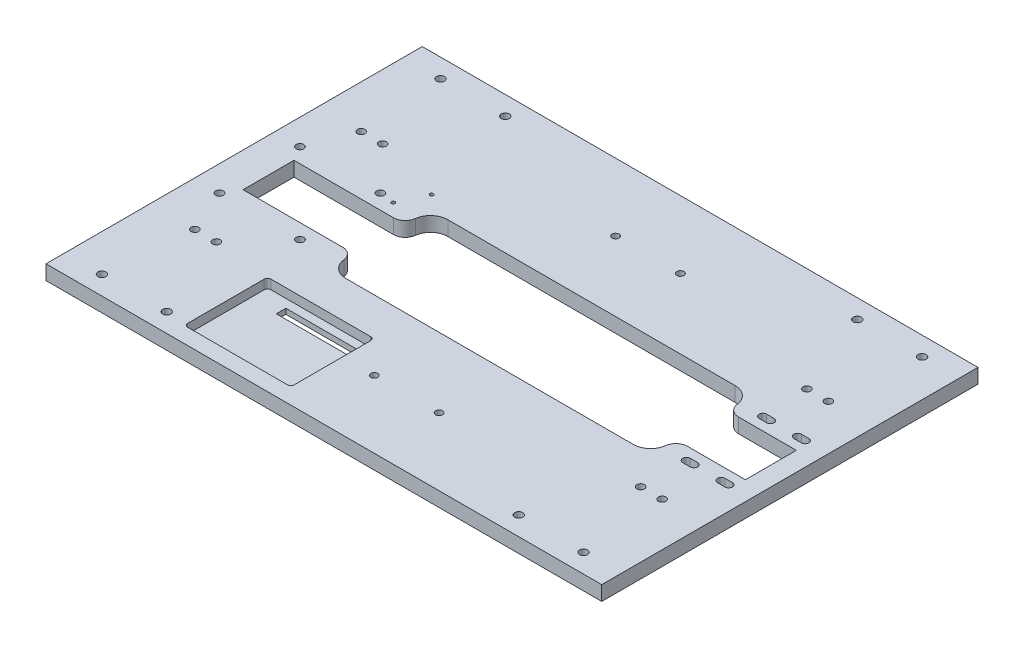
from build123d import *

# Parameters (mm, degrees)
SKETCH1_W           = 480
SKETCH1_H           = 325
BOSS_EXTRUDE1_DEPTH = 12.6
CUT_EXTRUDE1_REACH  = 292.112
SKETCH2_R           = 3
CUT_EXTRUDE2_REACH  = 292.112
FILLET1_R           = 10
CUT_EXTRUDE3_REACH  = 292.112
SKETCH4_R           = 3.3
FILLET2_R           = 10
CUT_EXTRUDE7_REACH  = 292.112
SKETCH7_R           = 2.25
SKETCH8_R           = 3.5
CUT_EXTRUDE8_DEPTH  = 6
CUT_EXTRUDE11_REACH = 292.112
SKETCH12_R          = 1.5
FILLET3_R           = 15
CUT_EXTRUDE12_DEPTH = 8
SKETCH14_W          = 63.584161833
SKETCH14_H          = 8.257095536
CUT_EXTRUDE13_DEPTH = 290.948702501
CUT_EXTRUDE14_REACH = 292.112
SKETCH15_R          = 3.25
CUT_EXTRUDE15_REACH = 292.112


with BuildPart() as part:
    # Sketch1 → Boss-Extrude1 (new body)
    with BuildSketch(Plane(origin=(0, 0, 0), x_dir=(1, 0, 0), z_dir=(0, 1, 0))):
        Rectangle(SKETCH1_W, SKETCH1_H)
    extrude(amount=BOSS_EXTRUDE1_DEPTH)

    # Sketch2 → Cut-Extrude1 (cut, up to next)
    with BuildSketch(Plane.XZ, mode=Mode.PRIVATE) as cut_extrude1_sk1:
        with Locations((41.247428317, -104.2)):
            Circle(SKETCH2_R)
    cut_extrude1_tool1 = extrude(cut_extrude1_sk1.sketch, amount=-CUT_EXTRUDE1_REACH, mode=Mode.PRIVATE) & part.part
    # Sketch2 → Cut-Extrude1 (cut, up to next)
    with BuildSketch(Plane.XZ, mode=Mode.PRIVATE) as cut_extrude1_sk2:
        with Locations((-14.752571683, -104.2)):
            Circle(SKETCH2_R)
    cut_extrude1_tool2 = extrude(cut_extrude1_sk2.sketch, amount=-CUT_EXTRUDE1_REACH, mode=Mode.PRIVATE) & part.part
    # Sketch2 → Cut-Extrude1 (cut, up to next)
    with BuildSketch(Plane.XZ, mode=Mode.PRIVATE) as cut_extrude1_sk3:
        with Locations((41.247428317, 104.2)):
            Circle(SKETCH2_R)
    cut_extrude1_tool3 = extrude(cut_extrude1_sk3.sketch, amount=-CUT_EXTRUDE1_REACH, mode=Mode.PRIVATE) & part.part
    # Sketch2 → Cut-Extrude1 (cut, up to next)
    with BuildSketch(Plane.XZ, mode=Mode.PRIVATE) as cut_extrude1_sk4:
        with Locations((-14.752571683, 104.2)):
            Circle(SKETCH2_R)
    cut_extrude1_tool4 = extrude(cut_extrude1_sk4.sketch, amount=-CUT_EXTRUDE1_REACH, mode=Mode.PRIVATE) & part.part
    add(cut_extrude1_tool1.solids().sort_by_distance((41.247428, 0, -104.2))[0], mode=Mode.SUBTRACT)
    add(cut_extrude1_tool2.solids().sort_by_distance((-14.752572, 0, -104.2))[0], mode=Mode.SUBTRACT)
    add(cut_extrude1_tool3.solids().sort_by_distance((41.247428, 0, 104.2))[0], mode=Mode.SUBTRACT)
    add(cut_extrude1_tool4.solids().sort_by_distance((-14.752572, 0, 104.2))[0], mode=Mode.SUBTRACT)

    # Sketch3 → Cut-Extrude2 (cut, up to next)
    with BuildSketch(Plane.XZ, mode=Mode.PRIVATE) as cut_extrude2_sk1:
        Polygon((163.584746975, 44), (-114.288669968, 44), (-114.288669968, 22), (-210.288669968, 22), (-210.288669968, -22), (-114.288669968, -22), (-114.288669968, -44), (163.584746975, -44), (163.584746975, -22), (223.584746975, -22), (223.584746975, 22), (163.584746975, 22), align=None)
    cut_extrude2_tool1 = extrude(cut_extrude2_sk1.sketch, amount=-CUT_EXTRUDE2_REACH, mode=Mode.PRIVATE) & part.part
    add(cut_extrude2_tool1.solids().sort_by_distance((13.675427, 0, 0))[0], mode=Mode.SUBTRACT)

    # Fillet1
    fillet1_edges = [part.edges().sort_by_distance(p)[0] for p in [
        (-114.288669968, 6.3, 22),
        (-114.288669968, 6.3, -22),
    ]]
    fillet(fillet1_edges, radius=FILLET1_R)

    # Sketch4 → Cut-Extrude3 (cut, up to next)
    with BuildSketch(Plane.XZ, mode=Mode.PRIVATE) as cut_extrude3_sk1:
        with Locations((-148.425714853, -34.75)):
            Circle(SKETCH4_R)
    cut_extrude3_tool1 = extrude(cut_extrude3_sk1.sketch, amount=-CUT_EXTRUDE3_REACH, mode=Mode.PRIVATE) & part.part
    # Sketch4 → Cut-Extrude3 (cut, up to next)
    with BuildSketch(Plane.XZ, mode=Mode.PRIVATE) as cut_extrude3_sk2:
        with Locations((-148.425714853, 34.75)):
            Circle(SKETCH4_R)
    cut_extrude3_tool2 = extrude(cut_extrude3_sk2.sketch, amount=-CUT_EXTRUDE3_REACH, mode=Mode.PRIVATE) & part.part
    # Sketch4 → Cut-Extrude3 (cut, up to next)
    with BuildSketch(Plane.XZ, mode=Mode.PRIVATE) as cut_extrude3_sk3:
        with Locations((-217.925714853, 34.75)):
            Circle(SKETCH4_R)
    cut_extrude3_tool3 = extrude(cut_extrude3_sk3.sketch, amount=-CUT_EXTRUDE3_REACH, mode=Mode.PRIVATE) & part.part
    # Sketch4 → Cut-Extrude3 (cut, up to next)
    with BuildSketch(Plane.XZ, mode=Mode.PRIVATE) as cut_extrude3_sk4:
        with Locations((-217.925714853, -34.75)):
            Circle(SKETCH4_R)
    cut_extrude3_tool4 = extrude(cut_extrude3_sk4.sketch, amount=-CUT_EXTRUDE3_REACH, mode=Mode.PRIVATE) & part.part
    add(cut_extrude3_tool1.solids().sort_by_distance((-148.425715, 0, -34.75))[0], mode=Mode.SUBTRACT)
    add(cut_extrude3_tool2.solids().sort_by_distance((-148.425715, 0, 34.75))[0], mode=Mode.SUBTRACT)
    add(cut_extrude3_tool3.solids().sort_by_distance((-217.925715, 0, 34.75))[0], mode=Mode.SUBTRACT)
    add(cut_extrude3_tool4.solids().sort_by_distance((-217.925715, 0, -34.75))[0], mode=Mode.SUBTRACT)

    # Fillet2
    fillet2_edges = [part.edges().sort_by_distance(p)[0] for p in [
        (163.584746975, 6.3, -22),
        (163.584746975, 6.3, 22),
    ]]
    fillet(fillet2_edges, radius=FILLET2_R)

    # Sketch7 → Cut-Extrude7 (cut, up to next)
    with BuildSketch(Plane(origin=(0, 12.6, 0), x_dir=(1, 0, 0), z_dir=(0, 1, 0)), mode=Mode.PRIVATE) as cut_extrude7_sk1:
        with Locations((208, -146.2)):
            Circle(SKETCH7_R)
    cut_extrude7_tool1 = extrude(cut_extrude7_sk1.sketch, amount=-CUT_EXTRUDE7_REACH, mode=Mode.PRIVATE) & part.part
    # Sketch7 → Cut-Extrude7 (cut, up to next)
    with BuildSketch(Plane(origin=(0, 12.6, 0), x_dir=(1, 0, 0), z_dir=(0, 1, 0)), mode=Mode.PRIVATE) as cut_extrude7_sk2:
        with Locations((152, -146.2)):
            Circle(SKETCH7_R)
    cut_extrude7_tool2 = extrude(cut_extrude7_sk2.sketch, amount=-CUT_EXTRUDE7_REACH, mode=Mode.PRIVATE) & part.part
    # Sketch7 → Cut-Extrude7 (cut, up to next)
    with BuildSketch(Plane(origin=(0, 12.6, 0), x_dir=(1, 0, 0), z_dir=(0, 1, 0)), mode=Mode.PRIVATE) as cut_extrude7_sk3:
        with Locations((-152, -146.2)):
            Circle(SKETCH7_R)
    cut_extrude7_tool3 = extrude(cut_extrude7_sk3.sketch, amount=-CUT_EXTRUDE7_REACH, mode=Mode.PRIVATE) & part.part
    # Sketch7 → Cut-Extrude7 (cut, up to next)
    with BuildSketch(Plane(origin=(0, 12.6, 0), x_dir=(1, 0, 0), z_dir=(0, 1, 0)), mode=Mode.PRIVATE) as cut_extrude7_sk4:
        with Locations((-208, -146.2)):
            Circle(SKETCH7_R)
    cut_extrude7_tool4 = extrude(cut_extrude7_sk4.sketch, amount=-CUT_EXTRUDE7_REACH, mode=Mode.PRIVATE) & part.part
    # Sketch7 → Cut-Extrude7 (cut, up to next)
    with BuildSketch(Plane(origin=(0, 12.6, 0), x_dir=(1, 0, 0), z_dir=(0, 1, 0)), mode=Mode.PRIVATE) as cut_extrude7_sk5:
        with Locations((-208, 146.2)):
            Circle(SKETCH7_R)
    cut_extrude7_tool5 = extrude(cut_extrude7_sk5.sketch, amount=-CUT_EXTRUDE7_REACH, mode=Mode.PRIVATE) & part.part
    # Sketch7 → Cut-Extrude7 (cut, up to next)
    with BuildSketch(Plane(origin=(0, 12.6, 0), x_dir=(1, 0, 0), z_dir=(0, 1, 0)), mode=Mode.PRIVATE) as cut_extrude7_sk6:
        with Locations((-152, 146.2)):
            Circle(SKETCH7_R)
    cut_extrude7_tool6 = extrude(cut_extrude7_sk6.sketch, amount=-CUT_EXTRUDE7_REACH, mode=Mode.PRIVATE) & part.part
    # Sketch7 → Cut-Extrude7 (cut, up to next)
    with BuildSketch(Plane(origin=(0, 12.6, 0), x_dir=(1, 0, 0), z_dir=(0, 1, 0)), mode=Mode.PRIVATE) as cut_extrude7_sk7:
        with Locations((208, 146.2)):
            Circle(SKETCH7_R)
    cut_extrude7_tool7 = extrude(cut_extrude7_sk7.sketch, amount=-CUT_EXTRUDE7_REACH, mode=Mode.PRIVATE) & part.part
    # Sketch7 → Cut-Extrude7 (cut, up to next)
    with BuildSketch(Plane(origin=(0, 12.6, 0), x_dir=(1, 0, 0), z_dir=(0, 1, 0)), mode=Mode.PRIVATE) as cut_extrude7_sk8:
        with Locations((152, 146.2)):
            Circle(SKETCH7_R)
    cut_extrude7_tool8 = extrude(cut_extrude7_sk8.sketch, amount=-CUT_EXTRUDE7_REACH, mode=Mode.PRIVATE) & part.part
    add(cut_extrude7_tool1.solids().sort_by_distance((208, 12.6, 146.2))[0], mode=Mode.SUBTRACT)
    add(cut_extrude7_tool2.solids().sort_by_distance((152, 12.6, 146.2))[0], mode=Mode.SUBTRACT)
    add(cut_extrude7_tool3.solids().sort_by_distance((-152, 12.6, 146.2))[0], mode=Mode.SUBTRACT)
    add(cut_extrude7_tool4.solids().sort_by_distance((-208, 12.6, 146.2))[0], mode=Mode.SUBTRACT)
    add(cut_extrude7_tool5.solids().sort_by_distance((-208, 12.6, -146.2))[0], mode=Mode.SUBTRACT)
    add(cut_extrude7_tool6.solids().sort_by_distance((-152, 12.6, -146.2))[0], mode=Mode.SUBTRACT)
    add(cut_extrude7_tool7.solids().sort_by_distance((208, 12.6, -146.2))[0], mode=Mode.SUBTRACT)
    add(cut_extrude7_tool8.solids().sort_by_distance((152, 12.6, -146.2))[0], mode=Mode.SUBTRACT)

    # Sketch8 → Cut-Extrude8 (cut)
    with BuildSketch(Plane(origin=(0, 12.6, 0), x_dir=(1, 0, 0), z_dir=(0, 1, 0))):
        with Locations((208, 146.2)):
            Circle(SKETCH8_R)
        with Locations((152, 146.2)):
            Circle(SKETCH8_R)
        with Locations((-152, 146.2)):
            Circle(SKETCH8_R)
        with Locations((-208, 146.2)):
            Circle(SKETCH8_R)
        with Locations((208, -146.2)):
            Circle(SKETCH8_R)
        with Locations((152, -146.2)):
            Circle(SKETCH8_R)
        with Locations((-208, -146.2)):
            Circle(SKETCH8_R)
        with Locations((-152, -146.2)):
            Circle(SKETCH8_R)
    extrude(amount=-CUT_EXTRUDE8_DEPTH, mode=Mode.SUBTRACT)

    # Sketch12 → Cut-Extrude11 (cut, up to next)
    with BuildSketch(Plane.XZ, mode=Mode.PRIVATE) as cut_extrude11_sk1:
        with Locations((-135.814791711, -33.263055365)):
            Circle(SKETCH12_R)
    cut_extrude11_tool1 = extrude(cut_extrude11_sk1.sketch, amount=-CUT_EXTRUDE11_REACH, mode=Mode.PRIVATE) & part.part
    # Sketch12 → Cut-Extrude11 (cut, up to next)
    with BuildSketch(Plane.XZ, mode=Mode.PRIVATE) as cut_extrude11_sk2:
        with Locations((-125.214791711, -55.863055365)):
            Circle(SKETCH12_R)
    cut_extrude11_tool2 = extrude(cut_extrude11_sk2.sketch, amount=-CUT_EXTRUDE11_REACH, mode=Mode.PRIVATE) & part.part
    add(cut_extrude11_tool1.solids().sort_by_distance((-135.814792, 0, -33.263055))[0], mode=Mode.SUBTRACT)
    add(cut_extrude11_tool2.solids().sort_by_distance((-125.214792, 0, -55.863055))[0], mode=Mode.SUBTRACT)

    # Fillet3
    fillet3_edges = [part.edges().sort_by_distance(p)[0] for p in [
        (163.584746975, 6.3, 44),
        (163.584746975, 6.3, -44),
        (-114.288669968, 6.3, 44),
        (-114.288669968, 6.3, -44),
    ]]
    fillet(fillet3_edges, radius=FILLET3_R)

    # Sketch9 → Cut-Extrude12 (cut)
    with BuildSketch(Plane(origin=(0, 12.6, 0), x_dir=(1, 0, 0), z_dir=(0, 1, 0))):
        with BuildLine():
            Line((-131.275181306, -76.793200215), (-45.275181306, -76.793200215))
            ThreePointArc((-45.275181306, -76.793200215), (-43.153860962, -77.671879872), (-42.275181306, -79.793200215))
            Line((-42.275181306, -79.793200215), (-42.275181306, -145.793200215))
            ThreePointArc((-42.275181306, -145.793200215), (-43.153860962, -147.914520559), (-45.275181306, -148.793200215))
            Line((-45.275181306, -148.793200215), (-131.275181306, -148.793200215))
            ThreePointArc((-131.275181306, -148.793200215), (-133.396501649, -147.914520559), (-134.275181306, -145.793200215))
            Line((-134.275181306, -145.793200215), (-134.275181306, -79.793200215))
            ThreePointArc((-134.275181306, -79.793200215), (-133.396501649, -77.671879872), (-131.275181306, -76.793200215))
        make_face()
    extrude(amount=-CUT_EXTRUDE12_DEPTH, mode=Mode.SUBTRACT)

    # Sketch14 → Cut-Extrude13 (cut, through all)
    with BuildSketch(Plane(origin=(0, 4.6, 0), x_dir=(1, 0, 0), z_dir=(0, 1, 0))):
        with Locations((-79.365102285, -88.291865052)):
            Rectangle(SKETCH14_W, SKETCH14_H)
    extrude(amount=-CUT_EXTRUDE13_DEPTH, mode=Mode.SUBTRACT)

    # Sketch15 → Cut-Extrude14 (cut, up to next)
    with BuildSketch(Plane(origin=(0, 12.6, 0), x_dir=(1, 0, 0), z_dir=(0, 1, 0)), mode=Mode.PRIVATE) as cut_extrude14_sk1:
        with Locations((-201.37519906, -72.5)):
            Circle(SKETCH15_R)
    cut_extrude14_tool1 = extrude(cut_extrude14_sk1.sketch, amount=-CUT_EXTRUDE14_REACH, mode=Mode.PRIVATE) & part.part
    # Sketch15 → Cut-Extrude14 (cut, up to next)
    with BuildSketch(Plane(origin=(0, 12.6, 0), x_dir=(1, 0, 0), z_dir=(0, 1, 0)), mode=Mode.PRIVATE) as cut_extrude14_sk2:
        with Locations((-182.864719491, -72.5)):
            Circle(SKETCH15_R)
    cut_extrude14_tool2 = extrude(cut_extrude14_sk2.sketch, amount=-CUT_EXTRUDE14_REACH, mode=Mode.PRIVATE) & part.part
    # Sketch15 → Cut-Extrude14 (cut, up to next)
    with BuildSketch(Plane(origin=(0, 12.6, 0), x_dir=(1, 0, 0), z_dir=(0, 1, 0)), mode=Mode.PRIVATE) as cut_extrude14_sk3:
        with Locations((-202.794137534, 72.512343256)):
            Circle(SKETCH15_R)
    cut_extrude14_tool3 = extrude(cut_extrude14_sk3.sketch, amount=-CUT_EXTRUDE14_REACH, mode=Mode.PRIVATE) & part.part
    # Sketch15 → Cut-Extrude14 (cut, up to next)
    with BuildSketch(Plane(origin=(0, 12.6, 0), x_dir=(1, 0, 0), z_dir=(0, 1, 0)), mode=Mode.PRIVATE) as cut_extrude14_sk4:
        with Locations((-184.283657965, 72.512343256)):
            Circle(SKETCH15_R)
    cut_extrude14_tool4 = extrude(cut_extrude14_sk4.sketch, amount=-CUT_EXTRUDE14_REACH, mode=Mode.PRIVATE) & part.part
    # Sketch15 → Cut-Extrude14 (cut, up to next)
    with BuildSketch(Plane(origin=(0, 12.6, 0), x_dir=(1, 0, 0), z_dir=(0, 1, 0)), mode=Mode.PRIVATE) as cut_extrude14_sk5:
        with Locations((182.205862466, 72.5)):
            Circle(SKETCH15_R)
    cut_extrude14_tool5 = extrude(cut_extrude14_sk5.sketch, amount=-CUT_EXTRUDE14_REACH, mode=Mode.PRIVATE) & part.part
    # Sketch15 → Cut-Extrude14 (cut, up to next)
    with BuildSketch(Plane(origin=(0, 12.6, 0), x_dir=(1, 0, 0), z_dir=(0, 1, 0)), mode=Mode.PRIVATE) as cut_extrude14_sk6:
        with Locations((200.716342035, 72.5)):
            Circle(SKETCH15_R)
    cut_extrude14_tool6 = extrude(cut_extrude14_sk6.sketch, amount=-CUT_EXTRUDE14_REACH, mode=Mode.PRIVATE) & part.part
    # Sketch15 → Cut-Extrude14 (cut, up to next)
    with BuildSketch(Plane(origin=(0, 12.6, 0), x_dir=(1, 0, 0), z_dir=(0, 1, 0)), mode=Mode.PRIVATE) as cut_extrude14_sk7:
        with Locations((183.62480094, -72.5)):
            Circle(SKETCH15_R)
    cut_extrude14_tool7 = extrude(cut_extrude14_sk7.sketch, amount=-CUT_EXTRUDE14_REACH, mode=Mode.PRIVATE) & part.part
    # Sketch15 → Cut-Extrude14 (cut, up to next)
    with BuildSketch(Plane(origin=(0, 12.6, 0), x_dir=(1, 0, 0), z_dir=(0, 1, 0)), mode=Mode.PRIVATE) as cut_extrude14_sk8:
        with Locations((202.135280509, -72.5)):
            Circle(SKETCH15_R)
    cut_extrude14_tool8 = extrude(cut_extrude14_sk8.sketch, amount=-CUT_EXTRUDE14_REACH, mode=Mode.PRIVATE) & part.part
    add(cut_extrude14_tool1.solids().sort_by_distance((-201.375199, 12.6, 72.5))[0], mode=Mode.SUBTRACT)
    add(cut_extrude14_tool2.solids().sort_by_distance((-182.864719, 12.6, 72.5))[0], mode=Mode.SUBTRACT)
    add(cut_extrude14_tool3.solids().sort_by_distance((-202.794138, 12.6, -72.512343))[0], mode=Mode.SUBTRACT)
    add(cut_extrude14_tool4.solids().sort_by_distance((-184.283658, 12.6, -72.512343))[0], mode=Mode.SUBTRACT)
    add(cut_extrude14_tool5.solids().sort_by_distance((182.205862, 12.6, -72.5))[0], mode=Mode.SUBTRACT)
    add(cut_extrude14_tool6.solids().sort_by_distance((200.716342, 12.6, -72.5))[0], mode=Mode.SUBTRACT)
    add(cut_extrude14_tool7.solids().sort_by_distance((183.624801, 12.6, 72.5))[0], mode=Mode.SUBTRACT)
    add(cut_extrude14_tool8.solids().sort_by_distance((202.135281, 12.6, 72.5))[0], mode=Mode.SUBTRACT)

    # Sketch16 → Cut-Extrude15 (cut, up to next)
    with BuildSketch(Plane(origin=(0, 12.6, 0), x_dir=(1, 0, 0), z_dir=(0, 1, 0)), mode=Mode.PRIVATE) as cut_extrude15_sk1:
        with BuildLine():
            Line((183.672880587, -36.25), (190.172880587, -36.25))
            ThreePointArc((190.172880587, -36.25), (193.422880587, -33), (190.172880587, -29.75))
            Line((190.172880587, -29.75), (183.672880587, -29.75))
            ThreePointArc((183.672880587, -29.75), (180.422880587, -33), (183.672880587, -36.25))
        make_face()
    cut_extrude15_tool1 = extrude(cut_extrude15_sk1.sketch, amount=-CUT_EXTRUDE15_REACH, mode=Mode.PRIVATE) & part.part
    # Sketch16 → Cut-Extrude15 (cut, up to next)
    with BuildSketch(Plane(origin=(0, 12.6, 0), x_dir=(1, 0, 0), z_dir=(0, 1, 0)), mode=Mode.PRIVATE) as cut_extrude15_sk2:
        with BuildLine():
            Line((213.672880587, -36.25), (220.172880587, -36.25))
            ThreePointArc((220.172880587, -36.25), (223.422880587, -33), (220.172880587, -29.75))
            Line((220.172880587, -29.75), (213.672880587, -29.75))
            ThreePointArc((213.672880587, -29.75), (210.422880587, -33), (213.672880587, -36.25))
        make_face()
    cut_extrude15_tool2 = extrude(cut_extrude15_sk2.sketch, amount=-CUT_EXTRUDE15_REACH, mode=Mode.PRIVATE) & part.part
    # Sketch16 → Cut-Extrude15 (cut, up to next)
    with BuildSketch(Plane(origin=(0, 12.6, 0), x_dir=(1, 0, 0), z_dir=(0, 1, 0)), mode=Mode.PRIVATE) as cut_extrude15_sk3:
        with BuildLine():
            Line((183.672880587, 29.75), (190.172880587, 29.75))
            ThreePointArc((190.172880587, 29.75), (193.422880587, 33), (190.172880587, 36.25))
            Line((190.172880587, 36.25), (183.672880587, 36.25))
            ThreePointArc((183.672880587, 36.25), (180.422880587, 33), (183.672880587, 29.75))
        make_face()
    cut_extrude15_tool3 = extrude(cut_extrude15_sk3.sketch, amount=-CUT_EXTRUDE15_REACH, mode=Mode.PRIVATE) & part.part
    # Sketch16 → Cut-Extrude15 (cut, up to next)
    with BuildSketch(Plane(origin=(0, 12.6, 0), x_dir=(1, 0, 0), z_dir=(0, 1, 0)), mode=Mode.PRIVATE) as cut_extrude15_sk4:
        with BuildLine():
            Line((213.672880587, 29.75), (220.172880587, 29.75))
            ThreePointArc((220.172880587, 29.75), (223.422880587, 33), (220.172880587, 36.25))
            Line((220.172880587, 36.25), (213.672880587, 36.25))
            ThreePointArc((213.672880587, 36.25), (210.422880587, 33), (213.672880587, 29.75))
        make_face()
    cut_extrude15_tool4 = extrude(cut_extrude15_sk4.sketch, amount=-CUT_EXTRUDE15_REACH, mode=Mode.PRIVATE) & part.part
    add(cut_extrude15_tool1.solids().sort_by_distance((186.922881, 12.6, 33))[0], mode=Mode.SUBTRACT)
    add(cut_extrude15_tool2.solids().sort_by_distance((216.922881, 12.6, 33))[0], mode=Mode.SUBTRACT)
    add(cut_extrude15_tool3.solids().sort_by_distance((186.922881, 12.6, -33))[0], mode=Mode.SUBTRACT)
    add(cut_extrude15_tool4.solids().sort_by_distance((216.922881, 12.6, -33))[0], mode=Mode.SUBTRACT)


solid = part.part
